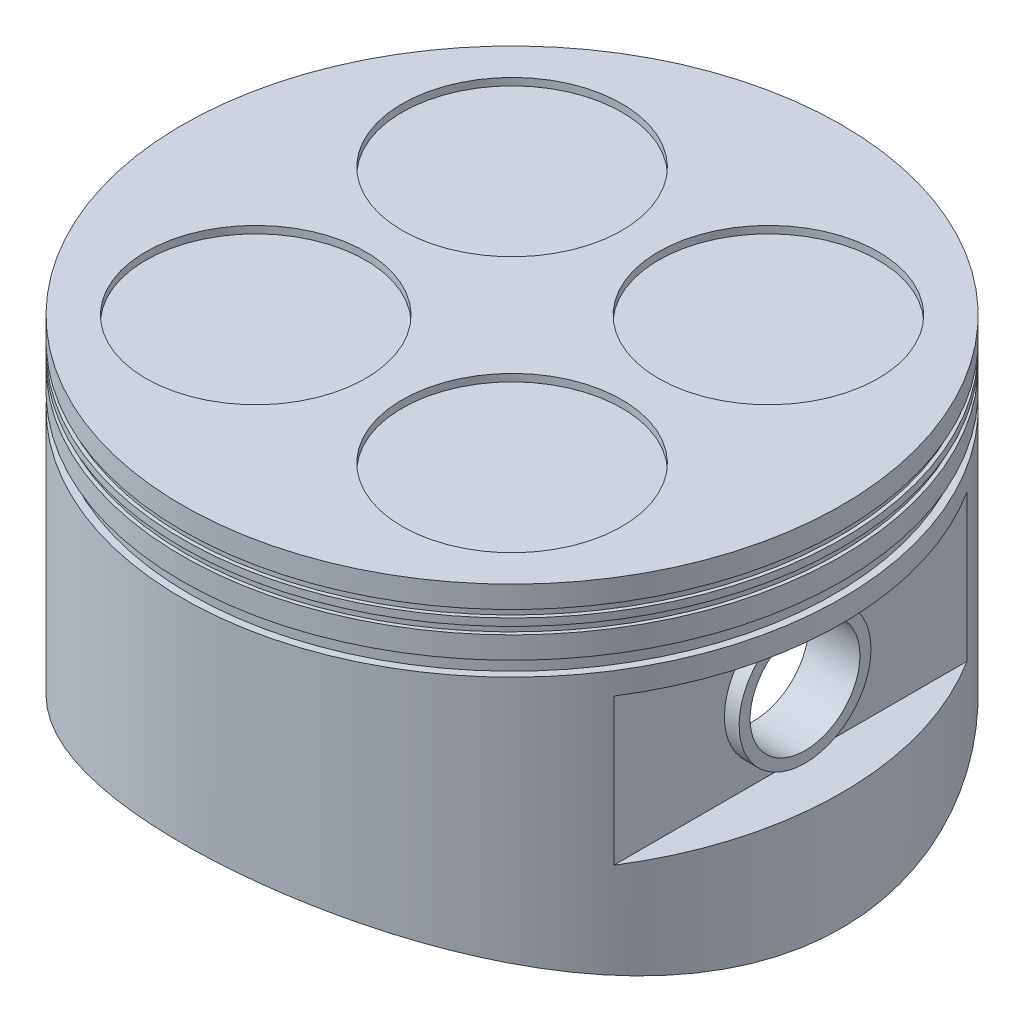
from build123d import *

# Parameters (mm, degrees)
SKETCH1_W               = 45
SKETCH1_H               = 50
CUT_EXTRUDE1_DEPTH      = 81.932070281
CUT_EXTRUDE1_DEPTH_BACK = 81.932070281
SKETCH2_W               = 10
SKETCH2_H               = 20
SHELL1_START            = 2.183039109
SHELL1_DEPTH            = 42.816960891
SHELL1_START_2          = 1.475e-06
SHELL1_2_DEPTH          = 10.999998525
SHELL1_START_3          = 41
SHELL1_3_DEPTH          = 4
SKETCH5_W               = 1
SKETCH5_H               = 1
SKETCH5_W_2             = 2
SKETCH5_H_2             = 2
SKETCH6_R               = 15
CUT_EXTRUDE4_DEPTH      = 1
SKETCH7_W               = 5
SKETCH7_H               = 25
BOSS_EXTRUDE1_DEPTH     = 30
CUT_EXTRUDE2_DEPTH      = 81.932070392
CUT_EXTRUDE2_DEPTH_BACK = 81.932070392
SKETCH3_R               = 7.5
FILLET1_R               = 5
SKETCH8_R               = 9
SKETCH8_R_2             = 7.5
BOSS_EXTRUDE2_DEPTH     = 2
FILLET2_R               = 5


with BuildPart() as part:
    # Sketch1 → Revolve1 (revolve)
    with BuildSketch(Plane.XY, mode=Mode.PRIVATE) as revolve1_sk:
        with Locations((22.5, 25)):
            Rectangle(SKETCH1_W, SKETCH1_H)
    revolve(revolve1_sk.sketch.rotate(Axis((0, 0, 0), (0, 1, 0)), 90), axis=Axis((0, 0, 0), (0, 1, 0)))

    # Sketch2 → Cut-Extrude1 (cut, two sides: drawn at the far end of the back side and taken through both)
    with BuildSketch(Plane.XY.offset(-CUT_EXTRUDE1_DEPTH_BACK)):
        with Locations((-43, 26)):
            Rectangle(SKETCH2_W, SKETCH2_H)
        with Locations((43, 26)):
            Rectangle(SKETCH2_W, SKETCH2_H)
        with BuildLine():
            Line((-45, 0), (-48, 0))
            Line((-48, 0), (-48, -7.78624056))
            Line((-48, -7.78624056), (48, -7.78624056))
            Line((48, -7.78624056), (48, 0))
            Line((48, 0), (45, 0))
            ThreePointArc((45, 0), (0, 10), (-45, 0))
        make_face()
    extrude(amount=CUT_EXTRUDE1_DEPTH + CUT_EXTRUDE1_DEPTH_BACK, mode=Mode.SUBTRACT)

    # Shell1: read off the stored shape, not the designer's step
    # Shell1 outline → Shell1 (cut)
    with BuildSketch(Plane(origin=(0, 0, 0), x_dir=(1, 0, 0), z_dir=(0, 1, 0)).offset(SHELL1_START)):
        with BuildLine():
            Line((33, -22.605309111), (33, 22.605309111))
            ThreePointArc((33, 22.605309111), (0, 40), (-33, 22.605309111))
            Line((-33, 22.605309111), (-33, -22.605309111))
            ThreePointArc((-33, -22.605309111), (0, -40), (33, -22.605309111))
        make_face()
    extrude(amount=SHELL1_DEPTH, mode=Mode.SUBTRACT)

    # Shell1 2 outline → Shell1 2 (cut)
    with BuildSketch(Plane(origin=(0, 0, 0), x_dir=(1, 0, 0), z_dir=(0, 1, 0)).offset(SHELL1_START_2)):
        with BuildLine():
            ThreePointArc((33, -22.605309111), (40, 0), (33, 22.605309111))
            Line((33, 22.605309111), (33, -22.605309111))
        make_face()
        with BuildLine():
            Line((-33, -22.605309111), (-33, 22.605309111))
            ThreePointArc((-33, 22.605309111), (-40, 0), (-33, -22.605309111))
        make_face()
    extrude(amount=SHELL1_2_DEPTH, mode=Mode.SUBTRACT)

    # Shell1 3 outline → Shell1 3 (cut)
    with BuildSketch(Plane(origin=(0, 0, 0), x_dir=(1, 0, 0), z_dir=(0, 1, 0)).offset(SHELL1_START_3)):
        with BuildLine():
            ThreePointArc((33, -22.605309111), (40, 0), (33, 22.605309111))
            Line((33, 22.605309111), (33, -22.605309111))
        make_face()
        with BuildLine():
            Line((-33, -22.605309111), (-33, 22.605309111))
            ThreePointArc((-33, 22.605309111), (-40, 0), (-33, -22.605309111))
        make_face()
    extrude(amount=SHELL1_3_DEPTH, mode=Mode.SUBTRACT)

    # Sketch5 → Cut-Revolve1 (revolve, cut)
    with BuildSketch(Plane.XY, mode=Mode.PRIVATE) as cut_revolve1_sk:
        with Locations((45, 46.5)):
            Rectangle(SKETCH5_W, SKETCH5_H)
        with Locations((45, 44.5)):
            Rectangle(SKETCH5_W, SKETCH5_H)
        with Locations((45, 40)):
            Rectangle(SKETCH5_W_2, SKETCH5_H_2)
    revolve(cut_revolve1_sk.sketch.rotate(Axis((0, 0, 0), (0, 1, 0)), 90), axis=Axis((0, 0, 0), (0, 1, 0)), mode=Mode.SUBTRACT)

    # Sketch6 → Cut-Extrude4 (cut)
    with BuildSketch(Plane(origin=(0, 50, 0), x_dir=(1, 0, 0), z_dir=(0, 1, 0))):
        with Locations(Location((-17.5, 17.5, 0), (0, 0, 270))):
            Circle(SKETCH6_R)
        with Locations(Location((17.5, 17.5, 0), (0, 0, 270))):
            Circle(SKETCH6_R)
        with Locations(Location((-17.5, -17.5, 0), (0, 0, 270))):
            Circle(SKETCH6_R)
        with Locations(Location((17.5, -17.5, 0), (0, 0, 270))):
            Circle(SKETCH6_R)
    extrude(amount=-CUT_EXTRUDE4_DEPTH, mode=Mode.SUBTRACT)

    # Sketch7 → Boss-Extrude1 (add)
    with BuildSketch(Plane.XZ.offset(-45)):
        with Locations((-10, 0)):
            Rectangle(SKETCH7_W, SKETCH7_H)
        with Locations((10, 0)):
            Rectangle(SKETCH7_W, SKETCH7_H)
    extrude(amount=BOSS_EXTRUDE1_DEPTH)

    # Sketch3 → Cut-Extrude2 (cut, two sides: drawn at the far end of the back side and taken through both)
    with BuildSketch(Plane(origin=(0, 0, 0), x_dir=(0, 0, -1), z_dir=(1, 0, 0)).offset(-CUT_EXTRUDE2_DEPTH_BACK)):
        with Locations((0, 26)):
            Circle(SKETCH3_R)
    extrude(amount=CUT_EXTRUDE2_DEPTH + CUT_EXTRUDE2_DEPTH_BACK, mode=Mode.SUBTRACT)

    # Fillet1
    fillet1_edges = [part.edges().sort_by_distance(p)[0] for p in [
        (-10, 15, -12.5),
        (-10, 15, 12.5),
        (10, 15, -12.5),
        (10, 15, 12.5),
    ]]
    fillet(fillet1_edges, radius=FILLET1_R)

    # Sketch8 → Boss-Extrude2 (add)
    with BuildSketch(Plane.ZY.offset(38)):
        with Locations(Location((0, 26, 0), (0, 0, 90))):
            Circle(SKETCH8_R)
        with Locations(Location((0, 26, 0), (0, 0, 180))):
            Circle(SKETCH8_R_2, mode=Mode.SUBTRACT)
    boss_extrude2 = extrude(amount=BOSS_EXTRUDE2_DEPTH)

    # Mirror1: Boss-Extrude2 across plane
    add(boss_extrude2.mirror(Plane(origin=(0, 0, 0), x_dir=(0, 0, 1), z_dir=(1, 0, 0))))

    # Fillet2
    fillet2_edges = [part.edges().sort_by_distance(p)[0] for p in [
        (-10, 45, -12.5),
        (-10, 45, 12.5),
        (10, 45, -12.5),
        (10, 45, 12.5),
    ]]
    fillet(fillet2_edges, radius=FILLET2_R)


solid = part.part
